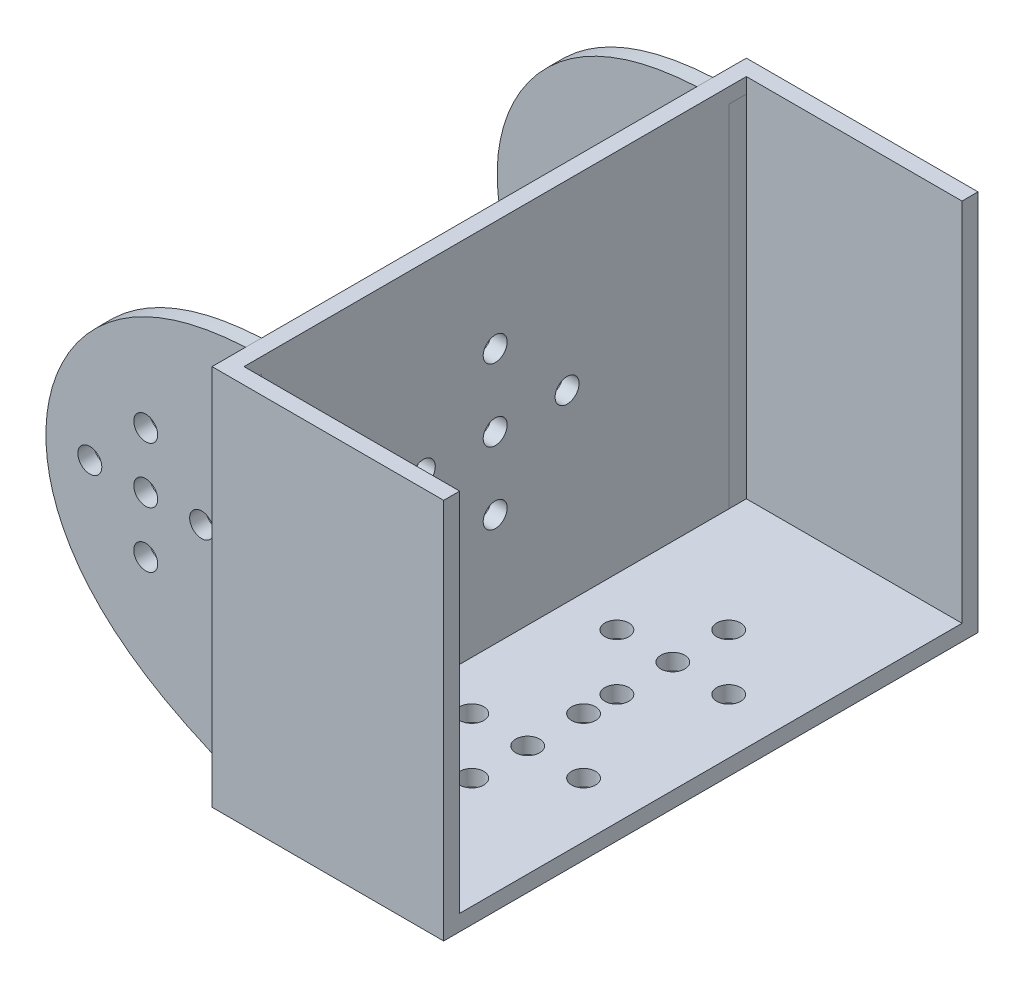
from build123d import *

# Parameters (mm, degrees)
BOSS_EXTRUDE2_START = -50
BOSS_EXTRUDE2_DEPTH = 100
FILLET2_R           = 1
SKETCH11_OUTSIDE_W  = 76.321
SKETCH11_OUTSIDE_H  = 126.318
CUT_EXTRUDE6_DEPTH  = 50
SKETCH21_W          = 25.00380553
SKETCH21_H          = 54.5
CUT_EXTRUDE18_DEPTH = 50
SKETCH14_R          = 1.5
CUT_EXTRUDE14_DEPTH = 30
SKETCH15_R          = 4.15
CUT_EXTRUDE15_DEPTH = 30
SHELL2_START        = -31.45
SHELL2_DEPTH        = 62.9
SHELL2_START_2      = -17.78576348
SHELL2_2_DEPTH      = 43.889459003
SKETCH22_W          = 62.9
SKETCH22_H          = 17.053565945
SKETCH22_H_2        = 1.226371558
SKETCH22_H_3        = 0.669933019
CUT_EXTRUDE19_DEPTH = 23
SKETCH18_R          = 1.5
CUT_EXTRUDE16_DEPTH = 30
SKETCH19_R          = 1.5
CUT_EXTRUDE17_DEPTH = 15
BOSS_EXTRUDE3_DEPTH = 4


with BuildPart() as part:
    # Boss-Extrude2: read off the stored shape, not the designer's step
    # Boss-Extrude2 outline → Boss-Extrude2 (new body)
    with BuildSketch(Plane.XY.offset(BOSS_EXTRUDE2_START)):
        with BuildLine():
            Line((7.173376116, 28), (-17.826623884, 28))
            add(Edge.make_bspline(
                [(-17.826623884, 28), (-27.185874908, 27.50099933), (-35.223916981, 24.964377467), (-41.44802417, 19.674318155), (-45.338717867, 12.08134087), (-46.286792493, 3.622346125), (-43.873364855, -4.224078001), (-38.072691487, -10.630357441), (-29.305703518, -15.557723074), (-17.826623884, -19.78576348)],
                knots=[0, 0, 0, 0, 0, 0, 0, 0, 0, 0, 1, 1, 1, 1, 1, 1, 1, 1, 1, 1], degree=9))
            Line((-17.826623884, -19.78576348), (7.173376116, -19.78576348))
            Line((7.173376116, -19.78576348), (7.173376116, 28))
        make_face()
    extrude(amount=BOSS_EXTRUDE2_DEPTH)

    # Fillet2
    # the kernel refuses this fillet: 1 mm, written as the material it takes off along each edge
    with BuildSketch(Plane(origin=(9.673376116, 28, 50), x_dir=(0, 0, -1), z_dir=(-1, 0, 0))) as fillet2_piece_1:
        with BuildLine():
            CenterArc((FILLET2_R, FILLET2_R), FILLET2_R, 180, 90)
            Line((0, FILLET2_R), (0, 0))
            Line((0, 0), (FILLET2_R, 0))
        make_face()
    extrude(amount=35, mode=Mode.SUBTRACT)
    with BuildSketch(Plane(origin=(7.173376116, -22.28576348, 50), x_dir=(0, 0, -1), z_dir=(0, 1, 0))) as fillet2_piece_2:
        with BuildLine():
            CenterArc((FILLET2_R, FILLET2_R), FILLET2_R, 180, 90)
            Line((0, FILLET2_R), (0, 0))
            Line((0, 0), (FILLET2_R, 0))
        make_face()
    extrude(amount=52.78576348, mode=Mode.SUBTRACT)

    # Sketch11 outside → Cut-Extrude6 (cut, symmetric)
    with BuildSketch(Plane(origin=(0, 0, 0), x_dir=(1, 0, 0), z_dir=(0, 1, 0))):
        with Locations((-17.8285, 0)):
            Rectangle(SKETCH11_OUTSIDE_W, SKETCH11_OUTSIDE_H)
        Polygon((7.173376116, -33.45), (7.173376116, 33.45), (-17.826623884, 33.45), (-17.830429414, 29.25), (-42.830429414, 29.25), (-42.830429414, -29.25), (-17.830429414, -29.25), (-17.826623884, -33.45), align=None, mode=Mode.SUBTRACT)
    extrude(amount=CUT_EXTRUDE6_DEPTH, both=True, mode=Mode.SUBTRACT)

    # Sketch21 → Cut-Extrude18 (cut)
    with BuildSketch(Plane(origin=(0, 28, 0), x_dir=(1, 0, 0), z_dir=(0, 1, 0))):
        with Locations((-30.328526649, 0)):
            Rectangle(SKETCH21_W, SKETCH21_H)
    extrude(amount=-CUT_EXTRUDE18_DEPTH, mode=Mode.SUBTRACT)

    # Sketch14 → Cut-Extrude14 (cut)
    with BuildSketch(Plane.XY.offset(29.25)):
        with Locations((-30.330429414, -1.001364342)):
            Circle(SKETCH14_R)
        with Locations((-30.330429414, 5.998635658)):
            Circle(SKETCH14_R)
        with Locations((-37.330429414, 5.998635658)):
            Circle(SKETCH14_R)
        with Locations((-30.330429414, 12.998635658)):
            Circle(SKETCH14_R)
        with Locations((-23.330429414, 5.998635658)):
            Circle(SKETCH14_R)
    extrude(amount=-CUT_EXTRUDE14_DEPTH, mode=Mode.SUBTRACT)

    # Sketch15 → Cut-Extrude15 (cut)
    with BuildSketch(Plane(origin=(0, 0, -29.25), x_dir=(-1, 0, 0), z_dir=(0, 0, -1))):
        with Locations((30.330429414, 5.998635658)):
            Circle(SKETCH15_R)
    extrude(amount=-CUT_EXTRUDE15_DEPTH, mode=Mode.SUBTRACT)

    # Shell2: read off the stored shape, not the designer's step
    # Shell2 outline → Shell2 (cut)
    with BuildSketch(Plane.XY.offset(SHELL2_START)):
        with BuildLine():
            Line((7.173376116, -17.78576348), (7.173376116, 27.330066981))
            add(Edge.make_bspline(
                [(7.173376116, 27.330066981), (5.64775073, 27.248726274), (4.122125344, 27.167385568), (2.596499959, 27.086044862), (1.070874573, 27.004704155), (-0.454750813, 26.923363449), (-1.980376199, 26.842022743), (-3.506001584, 26.760682036), (-5.03162697, 26.67934133), (-6.557252356, 26.598000624), (-8.082877742, 26.516659917), (-9.608503127, 26.435319211), (-11.455719773, 26.336832447), (-11.777311032, 26.31968639), (-12.098902291, 26.302540333), (-12.420493551, 26.285394276), (-12.74208481, 26.268248218), (-13.06367607, 26.251102161), (-13.385267329, 26.233956104), (-13.706858589, 26.216810047), (-14.028449848, 26.199663989), (-14.350041108, 26.182517932), (-14.671632367, 26.165371875), (-15.062673648, 26.144522999), (-15.132123669, 26.140820181), (-15.201573691, 26.137117362), (-15.271023712, 26.133414544), (-15.340473734, 26.129711725), (-15.409923755, 26.126008907), (-15.479373777, 26.122306089), (-15.548823798, 26.11860327), (-15.61827382, 26.114900452), (-15.687723841, 26.111197633), (-15.757173863, 26.107494815), (-15.826623884, 26.103791996)],
                knots=[-0.295530754, -0.295530754, -0.295530754, -0.295530754, -0.295530754, -0.295530754, -0.295530754, -0.295530754, -0.295530754, -0.295530754, -0.295530754, -0.295530754, -0.295530754, -0.078187809, -0.078187809, -0.078187809, -0.078187809, -0.078187809, -0.078187809, -0.078187809, -0.078187809, -0.078187809, -0.078187809, -0.078187809, -0.032373422, -0.032373422, -0.032373422, -0.032373422, -0.032373422, -0.032373422, -0.032373422, -0.032373422, -0.032373422, -0.032373422, -0.032373422, -0.022479465, -0.022479465, -0.022479465, -0.022479465, -0.022479465, -0.022479465, -0.022479465, -0.022479465, -0.022479465, -0.022479465, -0.022479465, -0.022479465, -0.022479465], degree=12))
            Line((-15.826623884, 26.103791996), (-15.826623884, -17.78576348))
            Line((-15.826623884, -17.78576348), (7.173376116, -17.78576348))
        make_face()
    extrude(amount=SHELL2_DEPTH, mode=Mode.SUBTRACT)

    # Shell2 2 outline → Shell2 2 (cut)
    with BuildSketch(Plane(origin=(0, 0, 0), x_dir=(1, 0, 0), z_dir=(0, 1, 0)).offset(SHELL2_START_2)):
        Polygon((-15.830428593, 29.25), (-15.826623884, 29.25), (-15.826623884, 31.45), (-15.82843522, 31.45), align=None)
        Polygon((-15.826623884, -29.25), (-15.830428593, -29.25), (-15.82843522, -31.45), (-15.826623884, -31.45), align=None)
    extrude(amount=SHELL2_2_DEPTH, mode=Mode.SUBTRACT)

    # Sketch22 → Cut-Extrude19 (cut)
    with BuildSketch(Plane(origin=(7.173376116, 0, 0), x_dir=(0, 0, -1), z_dir=(1, 0, 0))):
        with Locations((0, 36.526782973)):
            Rectangle(SKETCH22_W, SKETCH22_H)
        with Locations((0, 26.716881202)):
            Rectangle(SKETCH22_W, SKETCH22_H_2)
        with Locations((0, 27.665033491)):
            Rectangle(SKETCH22_W, SKETCH22_H_3)
    extrude(amount=-CUT_EXTRUDE19_DEPTH, mode=Mode.SUBTRACT)

    # Sketch18 → Cut-Extrude16 (cut)
    with BuildSketch(Plane.ZY.offset(27.826623884)):
        with Locations(Location((0, 5.207061298, 0), (0, 0, 180))):
            Circle(SKETCH18_R)
        with Locations(Location((-9, 5.207061298, 0), (0, 0, 180))):
            Circle(SKETCH18_R)
        with Locations(Location((0, -3.792938702, 0), (0, 0, 180))):
            Circle(SKETCH18_R)
        with Locations(Location((9, 5.207061298, 0), (0, 0, 180))):
            Circle(SKETCH18_R)
        with Locations(Location((0, 14.207061298, 0), (0, 0, 180))):
            Circle(SKETCH18_R)
    extrude(amount=-CUT_EXTRUDE16_DEPTH, mode=Mode.SUBTRACT)

    # Sketch19 → Cut-Extrude17 (cut, symmetric)
    with BuildSketch(Plane(origin=(0, -17.78576348, 0), x_dir=(1, 0, 0), z_dir=(0, 1, 0))):
        with Locations(Location((4.274529249, -9.034575671, 0), (0, 0, 270))):
            Circle(SKETCH19_R)
        with Locations(Location((-2.725470751, -16.034575671, 0), (0, 0, 270))):
            Circle(SKETCH19_R)
        with Locations(Location((-9.725470751, -9.034575671, 0), (0, 0, 270))):
            Circle(SKETCH19_R)
        with Locations(Location((-2.725470751, -9.034575671, 0), (0, 0, 270))):
            Circle(SKETCH19_R)
        with Locations(Location((-2.725470751, 16.134575671, 0), (0, 0, 270))):
            Circle(SKETCH19_R)
        with Locations(Location((4.274529249, 9.134575671, 0), (0, 0, 270))):
            Circle(SKETCH19_R)
        with Locations(Location((-2.725470751, 2.134575671, 0), (0, 0, 270))):
            Circle(SKETCH19_R)
        with Locations(Location((-9.725470751, 9.134575671, 0), (0, 0, 270))):
            Circle(SKETCH19_R)
        with Locations(Location((-2.725470751, 9.134575671, 0), (0, 0, 270))):
            Circle(SKETCH19_R)
        with Locations(Location((-2.725470751, -2.034575671, 0), (0, 0, 270))):
            Circle(SKETCH19_R)
    extrude(amount=CUT_EXTRUDE17_DEPTH, both=True, mode=Mode.SUBTRACT)

    # Sketch20 → Boss-Extrude3 (add)
    with BuildSketch(Plane(origin=(7.173376116, 0, 0), x_dir=(0, 0, -1), z_dir=(1, 0, 0))):
        Polygon((-31.45, -17.78576348), (-31.45, 28), (-33.45, 28), (-33.45, -19.78576348), (33.45, -19.78576348), (33.45, 28), (31.45, 28), (31.45, -17.78576348), align=None)
    extrude(amount=BOSS_EXTRUDE3_DEPTH)


solid = part.part
